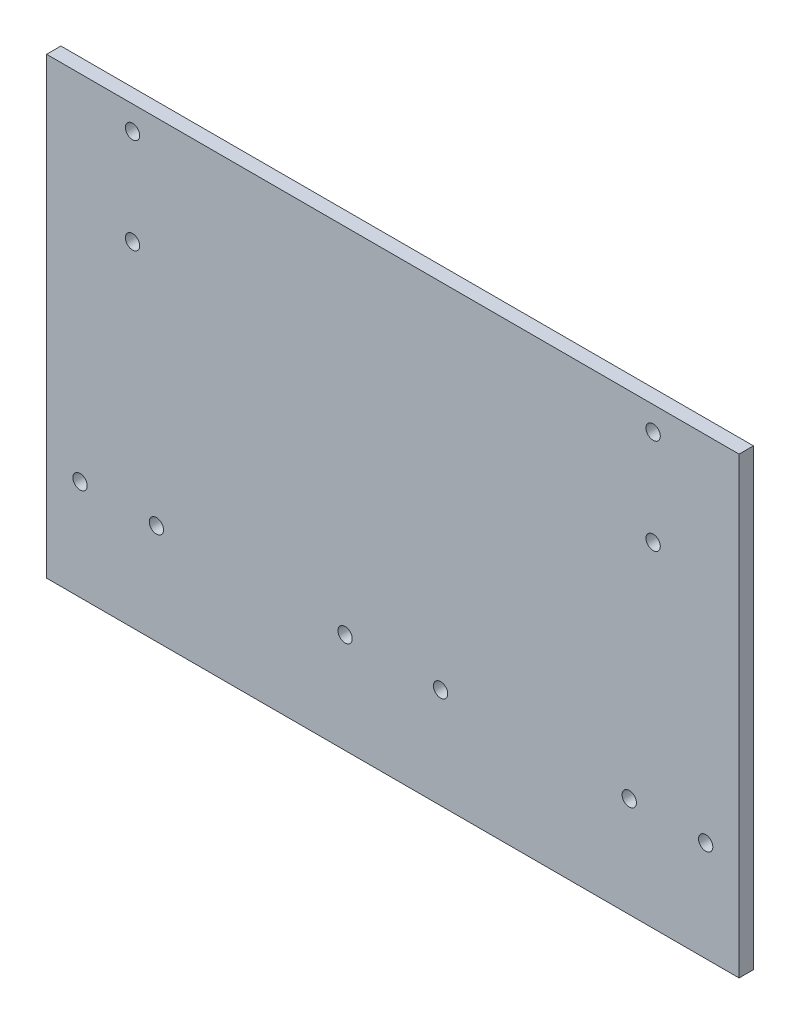
from build123d import *

# Parameters (mm, degrees)
SKETCH_1_W          = 145
SKETCH_1_H          = 95
EXTRUDE_1_DEPTH     = 3
SKETCH_2_R          = 1.5
CUT_EXTRUDE_1_DEPTH = 3
SKETCH_3_R          = 1.5
CUT_EXTRUDE_2_DEPTH = 3
SKETCH_4_R          = 1.5
CUT_EXTRUDE_4_DEPTH = 3


with BuildPart() as part:
    # 草图1 → 凸台-拉伸1 (new body)
    with BuildSketch(Plane.XY):
        Rectangle(SKETCH_1_W, SKETCH_1_H)
    extrude(amount=EXTRUDE_1_DEPTH)

    # 草图2 → 切除-拉伸1 (cut)
    with BuildSketch(Plane(origin=(0, 0, 0), x_dir=(-1, 0, 0), z_dir=(0, 0, -1))):
        with Locations((-49.5, -26.5)):
            Circle(SKETCH_2_R)
        with Locations((-65.5, -26.5)):
            Circle(SKETCH_2_R)
        with Locations((49.5, -26.5)):
            Circle(SKETCH_2_R)
        with Locations((65.5, -26.5)):
            Circle(SKETCH_2_R)
    extrude(amount=-CUT_EXTRUDE_1_DEPTH, mode=Mode.SUBTRACT)

    # 草图3 → 切除-拉伸2 (cut)
    with BuildSketch(Plane(origin=(0, 0, 0), x_dir=(-1, 0, 0), z_dir=(0, 0, -1))):
        with Locations((10, -26.5)):
            Circle(SKETCH_3_R)
        with Locations((-10, -26.5)):
            Circle(SKETCH_3_R)
    extrude(amount=-CUT_EXTRUDE_2_DEPTH, mode=Mode.SUBTRACT)

    # 草图4 → 切除-拉伸4 (cut)
    with BuildSketch(Plane(origin=(0, 0, 0), x_dir=(-1, 0, 0), z_dir=(0, 0, -1))):
        with Locations((-54.5, 42.5)):
            Circle(SKETCH_4_R)
        with Locations((-54.5, 22.5)):
            Circle(SKETCH_4_R)
        with Locations((54.5, 22.5)):
            Circle(SKETCH_4_R)
        with Locations((54.5, 42.5)):
            Circle(SKETCH_4_R)
    extrude(amount=-CUT_EXTRUDE_4_DEPTH, mode=Mode.SUBTRACT)


solid = part.part
